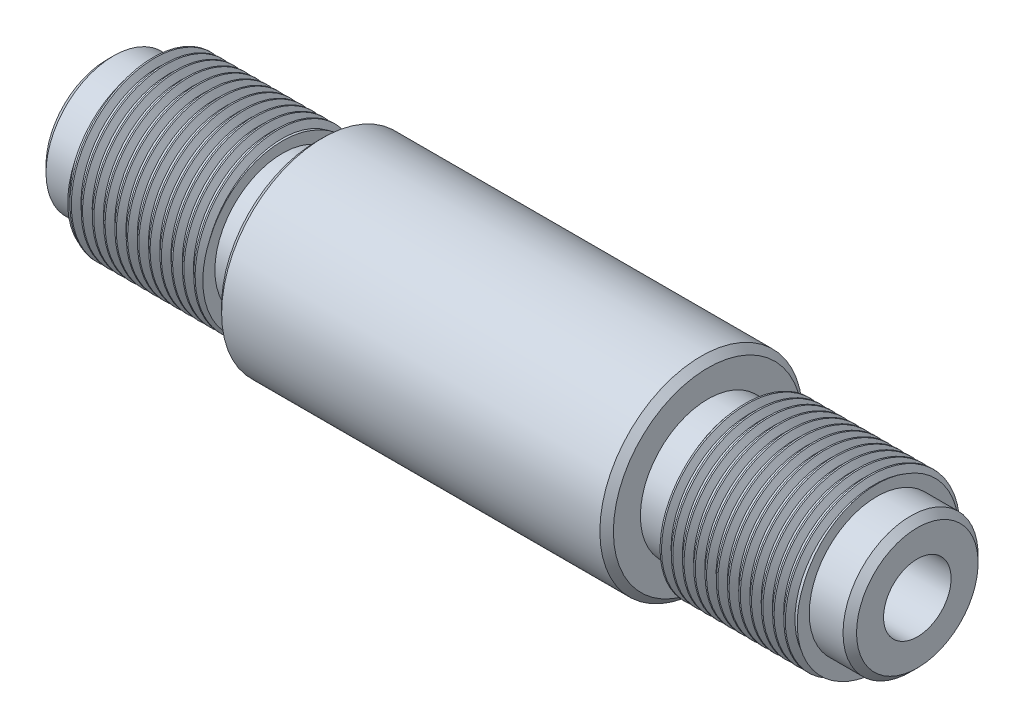
from build123d import *

# Parameters (mm, degrees)
THREAD1_PITCH = 2.116666667
CHAMFER1_SIZE = 1.27


with BuildPart() as part:
    # Sketch1 → Revolve1 (revolve)
    with BuildSketch(Plane.XY, mode=Mode.PRIVATE) as revolve1_sk:
        Polygon((-46.108280255, 6.35), (-46.108280255, 12.7), (-38.488280255, 12.7), (-38.488280255, 15.875), (-13.088280255, 15.875), (-13.088280255, 12.7), (-6.738280255, 12.7), (-6.738280255, 19.05), (30.091719745, 19.05), (30.091719745, 6.35), align=None)
    revolve(revolve1_sk.sketch.rotate(Axis((-46.108280255, 0, 0), (1, 0, 0)), 90), axis=Axis((-46.108280255, 0, 0), (1, 0, 0)))

    # Thread1: the profile of Thread Profile1 profile screwed along a right-hand helix of 12.75 turns, 10 arcs to a turn; built about Z, then put on its axis
    thread1_z = Axis((0, 0, 0), (0, 0, 1))
    thread1_corners = [(15.8753, 0, -0.000173205), (15.8753, 0, 1.852256533), (14.729320565, 0, 1.190624997), (14.729320565, 0, 0.661458331)]
    with BuildLine(mode=Mode.PRIVATE) as thread1_profile:
        Line(thread1_corners[0], thread1_corners[1])
        Line(thread1_corners[1], thread1_corners[2])
        Line(thread1_corners[2], thread1_corners[3])
        Line(thread1_corners[3], thread1_corners[0])
    thread1_cap = Face(thread1_profile.wire())
    thread1_turn_angles = [0, 18, 36, 54, 72, 90, 108, 126, 144, 162, 180, 198, 216, 234, 252, 270, 288, 306, 324, 342, 360]
    thread1_turn_weights = [1, 0.9510565162951535, 1, 0.9510565162951535, 1, 0.9510565162951535, 1, 0.9510565162951535, 1, 0.9510565162951535, 1, 0.9510565162951535, 1, 0.9510565162951535, 1, 0.9510565162951535, 1, 0.9510565162951535, 1, 0.9510565162951535, 1]
    thread1_turn_rails = [Edge.make_bspline([Vector(p[0], p[1], 0).rotate(thread1_z, thread1_turn_angles[k]) / thread1_turn_weights[k] + Vector(0, 0, p[2] + THREAD1_PITCH * thread1_turn_angles[k] / 360) for k in range(21)], [0, 0, 0, 1, 1, 2, 2, 3, 3, 4, 4, 5, 5, 6, 6, 7, 7, 8, 8, 9, 9, 10, 10, 10], 2, thread1_turn_weights) for p in thread1_corners]
    thread1_turn_sides = [Face.make_surface_from_curves(thread1_turn_rails[p[0]], thread1_turn_rails[p[1]]) for p in [(0, 1), (1, 2), (2, 3), (3, 0)]]
    thread1_last_angles = [4320, 4338, 4356, 4374, 4392, 4410, 4428, 4446, 4464, 4482, 4500, 4518, 4536, 4554, 4572, 4581, 4590]
    thread1_last_weights = [1, 0.9510565162951535, 1, 0.9510565162951535, 1, 0.9510565162951535, 1, 0.9510565162951535, 1, 0.9510565162951535, 1, 0.9510565162951535, 1, 0.9510565162951535, 1, 0.9876883405951378, 1]
    thread1_last_rails = [Edge.make_bspline([Vector(p[0], p[1], 0).rotate(thread1_z, thread1_last_angles[k]) / thread1_last_weights[k] + Vector(0, 0, p[2] + THREAD1_PITCH * thread1_last_angles[k] / 360) for k in range(17)], [0, 0, 0, 1, 1, 2, 2, 3, 3, 4, 4, 5, 5, 6, 6, 7, 7, 8, 8, 8], 2, thread1_last_weights) for p in thread1_corners]
    thread1_last_sides = [Face.make_surface_from_curves(thread1_last_rails[p[0]], thread1_last_rails[p[1]]) for p in [(0, 1), (1, 2), (2, 3), (3, 0)]]
    thread1 = Plane(origin=(-40.075780255, 0, 0), x_dir=(0, 0, -1), z_dir=(1, 0, 0)) * Solid(Shell([*[p.moved(Location((0, 0, THREAD1_PITCH * i))) for i in range(12) for p in thread1_turn_sides], *thread1_last_sides, thread1_cap, thread1_cap.rotate(thread1_z, 4590).moved(Location((0, 0, THREAD1_PITCH * 4590 / 360)))]))
    add(thread1, mode=Mode.SUBTRACT)

    # Mirror1: part across plane


with BuildPart() as part_1:
    add(part.part)
    add(part.part.mirror(Plane(origin=(30.091719745, 19.05, 0), x_dir=(0, 0, 1), z_dir=(-1, 0, 0))))

    # Chamfer1
    chamfer1_edges = [part_1.edges().sort_by_distance(p)[0] for p in [
        (-46.108280255, 0, -12.7),
        (106.291719745, 0, -12.7),
        (66.921719745, 0, -19.05),
        (-6.738280255, 0, -19.05),
    ]]
    chamfer(chamfer1_edges, length=CHAMFER1_SIZE)


solid = part_1.part
